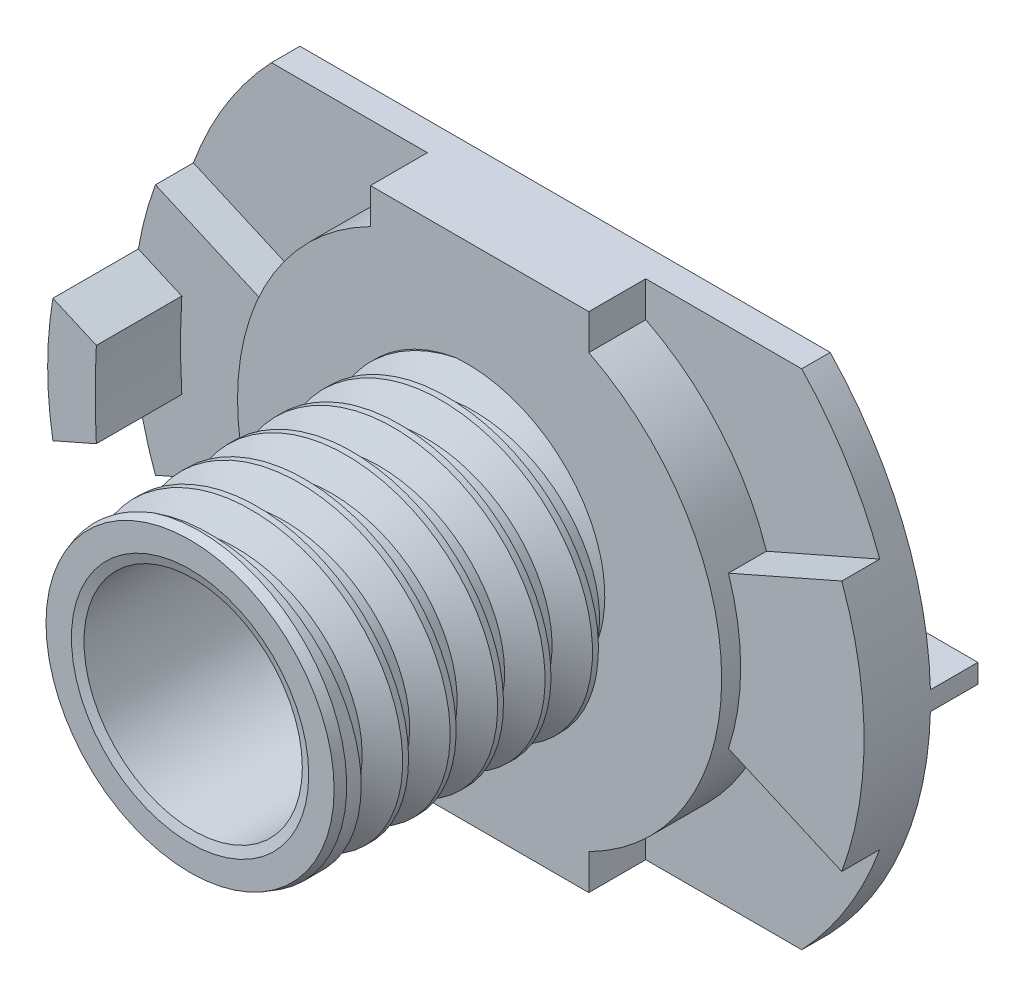
from build123d import *

# Parameters (mm, degrees)
BOSS_EXTRUDE1_DEPTH      = 0.3
BOSS_EXTRUDE2_START      = 0.3
BOSS_EXTRUDE2_DEPTH      = 1.2
BOSS_EXTRUDE3_START      = 0.3
BOSS_EXTRUDE3_DEPTH      = 0.8
BOSS_EXTRUDE4_START      = -0.3
BOSS_EXTRUDE4_DEPTH      = 1
BOSS_EXTRUDE5_DEPTH      = 7.6
BOSS_EXTRUDE5_DEPTH_BACK = 1.6
SKETCH5_R                = 3.1
CUT_EXTRUDE1_START       = 7.6
SKETCH6_R                = 2.3
CUT_EXTRUDE1_DEPTH       = 9.2
THREAD1_PITCH            = 1
THREAD1_TO               = 6.1
CHAMFER1_SIZE            = 0.064983939
CHAMFER1_SIZE_2          = 0.2
BOSS_EXTRUDE6_START      = 2.9
BOSS_EXTRUDE6_DEPTH      = 1.8


with BuildPart() as part:
    # Sketch1 → Boss-Extrude1 (new, symmetric)
    with BuildSketch(Plane.XY):
        with BuildLine():
            Line((-5.585696018, 5.3), (5.585696018, 5.3))
            ThreePointArc((5.585696018, 5.3), (7.7, 0), (5.585696018, -5.3))
            Line((5.585696018, -5.3), (-5.585696018, -5.3))
            ThreePointArc((-5.585696018, -5.3), (-7.7, 0), (-5.585696018, 5.3))
        make_face()
    extrude(amount=BOSS_EXTRUDE1_DEPTH, both=True)

    # Sketch2 → Boss-Extrude2 (add)
    with BuildSketch(Plane.XY.offset(BOSS_EXTRUDE2_START)):
        with BuildLine():
            Line((-2.3, 5.3), (2.3, 5.3))
            Line((2.3, 5.3), (2.3, 4.551922671))
            ThreePointArc((2.3, 4.551922671), (5.1, 0), (2.3, -4.551922671))
            Line((2.3, -4.551922671), (2.3, -5.3))
            Line((2.3, -5.3), (-2.3, -5.3))
            Line((-2.3, -5.3), (-2.3, -4.551922671))
            ThreePointArc((-2.3, -4.551922671), (-5.1, 0), (-2.3, 4.551922671))
            Line((-2.3, 4.551922671), (-2.3, 5.3))
        make_face()
    extrude(amount=BOSS_EXTRUDE2_DEPTH)

    # Sketch3 → Boss-Extrude3 (add)
    with BuildSketch(Plane.XY.offset(BOSS_EXTRUDE3_START)):
        with BuildLine():
            Line((4.842520005, 1.6), (7.229626546, 2.65))
            ThreePointArc((7.229626546, 2.65), (7.7, 0), (7.229626546, -2.65))
            Line((7.229626546, -2.65), (4.842520005, -1.6))
            ThreePointArc((4.842520005, -1.6), (5.1, 0), (4.842520005, 1.6))
        make_face()
        with BuildLine():
            Line((-4.842520005, 1.6), (-7.229626546, 2.65))
            ThreePointArc((-7.229626546, 2.65), (-7.7, 0), (-7.229626546, -2.65))
            Line((-7.229626546, -2.65), (-4.842520005, -1.6))
            ThreePointArc((-4.842520005, -1.6), (-5.1, 0), (-4.842520005, 1.6))
        make_face()
    extrude(amount=BOSS_EXTRUDE3_DEPTH)

    # Sketch4 → Boss-Extrude4 (add)
    with BuildSketch(Plane.XY.offset(BOSS_EXTRUDE4_START)):
        with BuildLine():
            ThreePointArc((7.697402159, 0.2), (7.7, 0), (7.697402159, -0.2))
            Line((7.697402159, -0.2), (5.997402159, -0.2))
            Line((5.997402159, -0.2), (5.997402159, 0))
            Line((5.997402159, 0), (5.997402159, 0.2))
            Line((5.997402159, 0.2), (7.697402159, 0.2))
        make_face()
        with BuildLine():
            Line((-5.997402159, 0.2), (-7.697402159, 0.2))
            ThreePointArc((-7.697402159, 0.2), (-7.7, 0), (-7.697402159, -0.2))
            Line((-7.697402159, -0.2), (-5.997402159, -0.2))
            Line((-5.997402159, -0.2), (-5.997402159, 0))
            Line((-5.997402159, 0), (-5.997402159, 0.2))
        make_face()
    extrude(amount=-BOSS_EXTRUDE4_DEPTH)

    # Sketch5 → Boss-Extrude5 (add, two sides: drawn at the far end of the back side and taken through both)
    with BuildSketch(Plane.XY.offset(-BOSS_EXTRUDE5_DEPTH_BACK)):
        Circle(SKETCH5_R)
    extrude(amount=BOSS_EXTRUDE5_DEPTH + BOSS_EXTRUDE5_DEPTH_BACK)

    # Sketch6 → Cut-Extrude1 (cut)
    with BuildSketch(Plane.XY.offset(CUT_EXTRUDE1_START)):
        Circle(SKETCH6_R)
    extrude(amount=-CUT_EXTRUDE1_DEPTH, mode=Mode.SUBTRACT)

    # Thread1: arcs per turn and ends read off the stored shape
    # Thread1: the profile of Thread Profile1 profile screwed along a right-hand helix through 6.1 turns, 8 arcs to a turn; built about Z, then put on its axis
    thread1_z = Axis((0, 0, 0), (0, 0, 1))
    thread1_corners = [(3.1003, 0, -0.000173205), (3.1003, 0, 0.875173202), (2.558734125, 0, 0.562499999), (2.558734125, 0, 0.312499999)]
    with BuildLine(mode=Mode.PRIVATE) as thread1_profile:
        Line(thread1_corners[0], thread1_corners[1])
        Line(thread1_corners[1], thread1_corners[2])
        Line(thread1_corners[2], thread1_corners[3])
        Line(thread1_corners[3], thread1_corners[0])
    thread1_cap = Face(thread1_profile.wire())
    thread1_turn_angles = [0, 22.5, 45, 67.5, 90, 112.5, 135, 157.5, 180, 202.5, 225, 247.5, 270, 292.5, 315, 337.5, 360]
    thread1_turn_weights = [1, 0.9238795325112867, 1, 0.9238795325112867, 1, 0.9238795325112867, 1, 0.9238795325112867, 1, 0.9238795325112867, 1, 0.9238795325112867, 1, 0.9238795325112867, 1, 0.9238795325112867, 1]
    thread1_turn_rails = [Edge.make_bspline([Vector(p[0], p[1], 0).rotate(thread1_z, thread1_turn_angles[k]) / thread1_turn_weights[k] + Vector(0, 0, p[2] + THREAD1_PITCH * thread1_turn_angles[k] / 360) for k in range(17)], [0, 0, 0, 1, 1, 2, 2, 3, 3, 4, 4, 5, 5, 6, 6, 7, 7, 8, 8, 8], 2, thread1_turn_weights) for p in thread1_corners]
    thread1_turn_sides = [Face.make_surface_from_curves(thread1_turn_rails[p[0]], thread1_turn_rails[p[1]]) for p in [(0, 1), (1, 2), (2, 3), (3, 0)]]
    thread1_last_angles = [2160, 2178, 2196]
    thread1_last_weights = [1, 0.9510565162951523, 1]
    thread1_last_rails = [Edge.make_bspline([Vector(p[0], p[1], 0).rotate(thread1_z, thread1_last_angles[k]) / thread1_last_weights[k] + Vector(0, 0, p[2] + THREAD1_PITCH * thread1_last_angles[k] / 360) for k in range(3)], [0, 0, 0, 1, 1, 1], 2, thread1_last_weights) for p in thread1_corners]
    thread1_last_sides = [Face.make_surface_from_curves(thread1_last_rails[p[0]], thread1_last_rails[p[1]]) for p in [(0, 1), (1, 2), (2, 3), (3, 0)]]
    thread1 = Plane(origin=(0, 0, 7.6), x_dir=(-1, 0, 0), z_dir=(0, 0, -1)) * split(Solid(Shell([*[p.moved(Location((0, 0, THREAD1_PITCH * i))) for i in range(6) for p in thread1_turn_sides], *thread1_last_sides, thread1_cap, thread1_cap.rotate(thread1_z, 2196).moved(Location((0, 0, THREAD1_PITCH * 2196 / 360)))])), bisect_by=Plane.XY.offset(THREAD1_TO), keep=Keep.BOTTOM, mode=Mode.PRIVATE)
    add(thread1, mode=Mode.SUBTRACT)

    # Chamfer1
    # the kernel refuses this chamfer: 0.2, 0.064983939 mm, written as the material it takes off along each edge
    with BuildSketch(Plane(origin=(0, 0, 7.6), x_dir=(1, 0, 0), z_dir=(0, -1, 0))) as chamfer1_piece_1:
        Polygon((3.1 - CHAMFER1_SIZE * 1.00000000379, 0), (3.1, -CHAMFER1_SIZE_2), (3.1, 0), align=None)
    revolve(axis=Axis((0, 0, 7.6), (0, 0, 1)), revolution_arc=180, mode=Mode.SUBTRACT)
    with BuildSketch(Plane(origin=(0, 0, 7.6), x_dir=(1, 0, 0), z_dir=(0, -1, 0))) as chamfer1_piece_2:
        Polygon((2.3, -CHAMFER1_SIZE * 1.00000000379), (2.3 + CHAMFER1_SIZE_2, 0), (2.3, 0), align=None)
    revolve(axis=Axis((0, 0, 7.6), (0, 0, 1)), mode=Mode.SUBTRACT)
    with BuildSketch(Plane(origin=(0, 0, 7.6), x_dir=(-1, 0, 0), z_dir=(0, 1, 0))) as chamfer1_piece_3:
        Polygon((3.1 - CHAMFER1_SIZE * 1.00000000379, 0), (3.1, -CHAMFER1_SIZE_2), (3.1, 0), align=None)
    revolve(axis=Axis((0, 0, 7.6), (0, 0, 1)), revolution_arc=180, mode=Mode.SUBTRACT)

    # Sketch11 → Boss-Extrude6 (add)
    with BuildSketch(Plane.XY.offset(BOSS_EXTRUDE6_START)):
        with BuildLine():
            Line((-7.589466384, 1.3), (-6.674105152, 0.897366403))
            ThreePointArc((-6.674105152, 0.897366403), (-6.7, 0), (-6.674105152, -0.897366403))
            Line((-6.674105152, -0.897366403), (-7.589466384, -1.3))
            ThreePointArc((-7.589466384, -1.3), (-7.7, 0), (-7.589466384, 1.3))
        make_face()
    extrude(amount=-BOSS_EXTRUDE6_DEPTH)


solid = part.part
